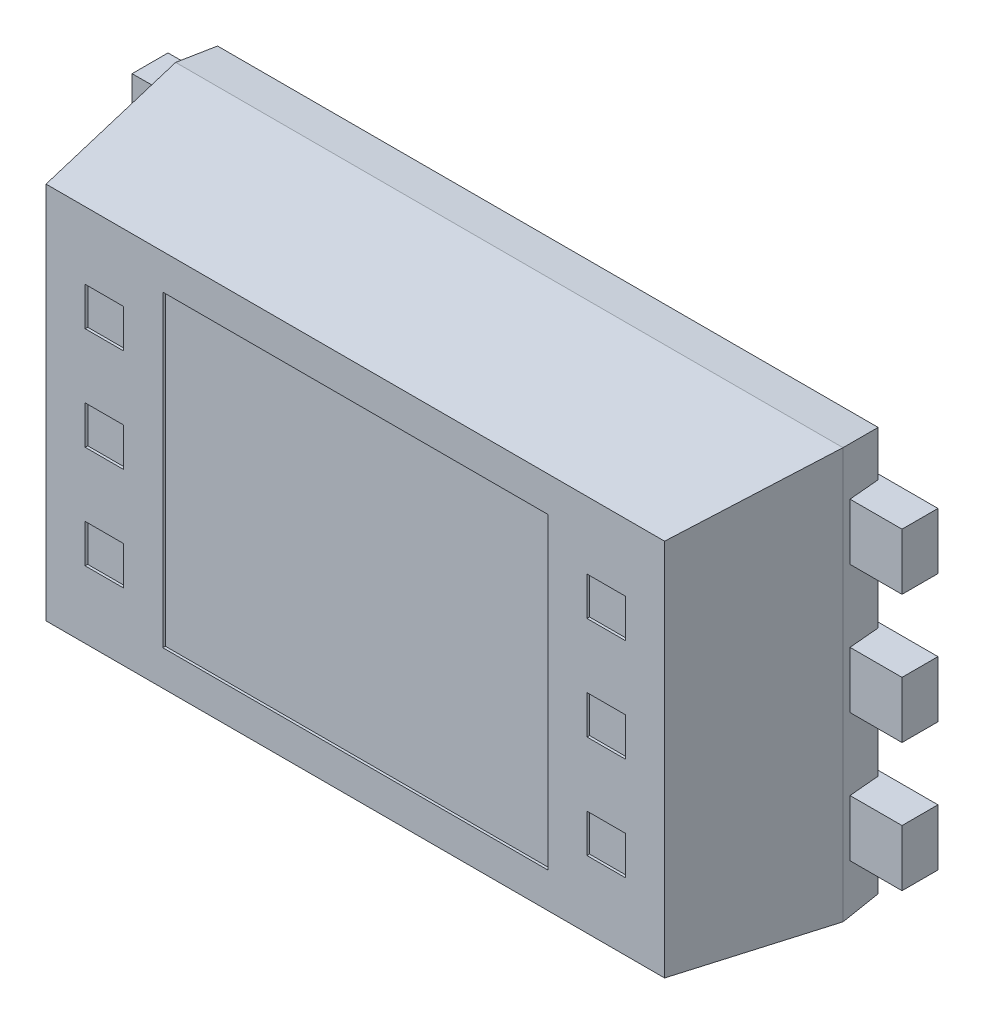
from build123d import *
from OCP.BRepFilletAPI import BRepFilletAPI_MakeChamfer

# Parameters (mm, degrees)
SKETCH_1_W                = 2.6
SKETCH_1_H                = 1.6
EXTRUDE_1_DEPTH           = 0.6
EXTRUDE_1_OTHER_WAY_DEPTH = 0.15
EXTRUDE_1_OTHER_WAY_TAPER = 5
CHAMFER_1_SIZE            = 0.6
CHAMFER_1_SIZE_2          = 0.095030664
CHAMFER_2_SIZE            = 0.6
CHAMFER_2_SIZE_2          = 0.063062541
EXTRUDE_2_DEPTH           = 0.02
EXTRUDE_2_DEPTH_BACK      = 0.12
SKETCH_5_W                = 0.15
SKETCH_5_H                = 0.15
SKETCH_5_W_2              = 1.5
SKETCH_5_H_2              = 1.2
CUT_EXTRUDE_1_DEPTH       = 0.01


# Some blends are built 0.0001 mm under size
with BuildPart() as part:
    # Эскиз1 → Бобышка-Вытянуть1 (new body)
    with BuildSketch(Plane.XY):
        with Locations((1.3, 0.8)):
            Rectangle(SKETCH_1_W, SKETCH_1_H)
    extrude(amount=EXTRUDE_1_DEPTH)

    # Эскиз1 → Бобышка-Вытянуть1 other way (add)
    with BuildSketch(Plane.XY):
        with Locations((1.3, 0.8)):
            Rectangle(SKETCH_1_W, SKETCH_1_H)
    extrude(amount=-EXTRUDE_1_OTHER_WAY_DEPTH, taper=EXTRUDE_1_OTHER_WAY_TAPER)

    # Фаска1
    # the kernel refuses this chamfer: 0.6, 0.095030664 mm, written as the material it takes off along each edge
    with BuildSketch(Plane(origin=(0, 3.15928955, 0.6), x_dir=(-0.006019451551713199, 0, -0.9999818829373943), z_dir=(0, -1, 0)), Plane(origin=(2.6, -1.55928955, 0.6), x_dir=(0.006019451551713157, 0, -0.9999818829373943), z_dir=(0, 1, 0))) as chamfer_1_piece_1:
        Polygon((CHAMFER_1_SIZE * 0.999981882937, CHAMFER_1_SIZE * 0.00601945155171), (-CHAMFER_1_SIZE_2 * 0.00601945156405, CHAMFER_1_SIZE_2 * 0.999981884986), (0, 0), align=None)
    extrude(amount=4.7185791, mode=Mode.SUBTRACT)

    # Фаска2
    chamfer_2_edges_1 = [part.edges().sort_by_distance(p)[0] for p in [
        (1.3, 0, 0.6),
    ]]
    chamfer_2_side_1 = [part.faces().sort_by_distance(p)[0] for p in [
        (1.3, 0, 0.598738749),
    ]]
    chamfer_2_edges_2 = [part.edges().sort_by_distance(p)[0] for p in [
        (1.3, 1.6, 0.6),
    ]]
    chamfer_2_side_2 = [part.faces().sort_by_distance(p)[0] for p in [
        (1.3, 1.598738749, 0.6),
    ]]
    chamfer_2 = BRepFilletAPI_MakeChamfer(part.part.solid().wrapped)
    for e in chamfer_2_edges_1:
        chamfer_2.Add(CHAMFER_2_SIZE - 0.0001, CHAMFER_2_SIZE_2 - 0.0001, e.wrapped, chamfer_2_side_1[0].wrapped)
    for e in chamfer_2_edges_2:
        chamfer_2.Add(CHAMFER_2_SIZE_2 - 0.0001, CHAMFER_2_SIZE - 0.0001, e.wrapped, chamfer_2_side_2[0].wrapped)
    add(Compound.cast(chamfer_2.Shape()), mode=Mode.REPLACE)  # a hair under: the kernel refuses the full size

    # Эскиз4 → Бобышка-Вытянуть2 (add, two sides: drawn at the far end of the back side and taken through both)
    with BuildSketch(Plane(origin=(0, 0, -0.15), x_dir=(-1, 0, 0), z_dir=(0, 0, -1)).offset(-EXTRUDE_2_DEPTH_BACK)):
        Polygon((-2.8, 0.8), (-2.8, 0.69), (-2.53, 0.69), (-2.53, 0.91), (-2.8, 0.91), align=None)
        Polygon((-0.07, 0.41), (0.2, 0.41), (0.2, 0.3), (0.2, 0.19), (-0.07, 0.19), align=None)
        Polygon((-2.8, 0.3), (-2.8, 0.19), (-2.53, 0.19), (-2.53, 0.41), (-2.8, 0.41), align=None)
        Polygon((-0.07, 0.91), (0.2, 0.91), (0.2, 0.8), (0.2, 0.69), (-0.07, 0.69), align=None)
        Polygon((-2.8, 1.3), (-2.8, 1.19), (-2.53, 1.19), (-2.53, 1.41), (-2.8, 1.41), align=None)
        Polygon((-0.07, 1.4493767), (-0.07, 1.1768767), (0.2, 1.1768767), (0.2, 1.3118767), (0.2, 1.4468767), align=None)
    extrude(amount=EXTRUDE_2_DEPTH + EXTRUDE_2_DEPTH_BACK)

    # Эскиз5 → Вырез-Вытянуть1 (cut)
    with BuildSketch(Plane.XY.offset(0.6)):
        with Locations((0.322515332, 1.2)):
            Rectangle(SKETCH_5_W, SKETCH_5_H)
        with Locations((2.277484668, 0.8)):
            Rectangle(SKETCH_5_W, SKETCH_5_H)
        with Locations((1.3, 0.8)):
            Rectangle(SKETCH_5_W_2, SKETCH_5_H_2)
        with Locations((0.322515332, 0.8)):
            Rectangle(SKETCH_5_W, SKETCH_5_H)
        with Locations((0.322515332, 0.4)):
            Rectangle(SKETCH_5_W, SKETCH_5_H)
        with Locations((2.277484668, 0.4)):
            Rectangle(SKETCH_5_W, SKETCH_5_H)
        with Locations((2.277484668, 1.2)):
            Rectangle(SKETCH_5_W, SKETCH_5_H)
    extrude(amount=-CUT_EXTRUDE_1_DEPTH, mode=Mode.SUBTRACT)


solid = part.part
